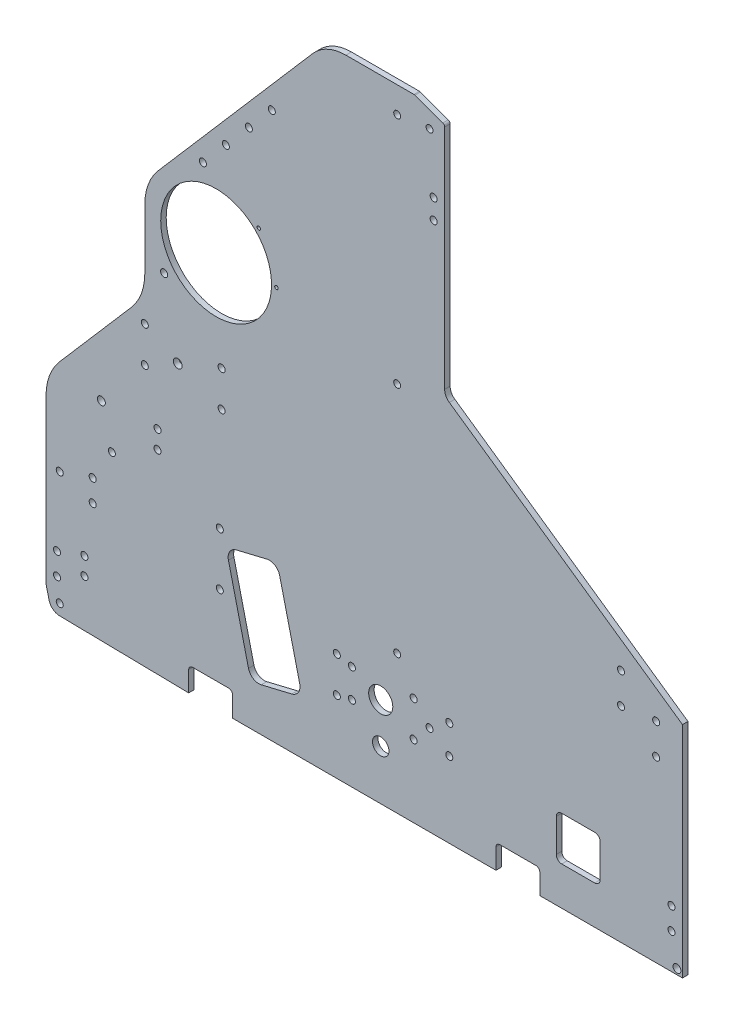
from build123d import *

# Parameters (mm, degrees)
SKETCH1_R           = 2.032
SKETCH1_R_2         = 2.54
SKETCH1_R_3         = 2
BOSS_EXTRUDE1_DEPTH = 3.175
FILLET1_R           = 2.286
FILLET2_R           = 6.35
SKETCH2_R           = 2.032
CUT_EXTRUDE1_DEPTH  = 505.524983177
FILLET3_R           = 1.5875
SKETCH3_R           = 2.032
SKETCH3_R_2         = 2.286
SKETCH3_R_3         = 1.016
CUT_EXTRUDE2_DEPTH  = 505.524983177
SKETCH4_R           = 2.032
SKETCH4_R_2         = 6.985
SKETCH4_R_3         = 4.7625
CUT_EXTRUDE3_DEPTH  = 505.524983177
SKETCH5_R           = 32.0675
SKETCH5_R_2         = 2.286
CUT_EXTRUDE5_DEPTH  = 540.282510524
FILLET4_R           = 31.75
CUT_EXTRUDE6_DEPTH  = 505.524983177
SKETCH7_R           = 2.032
CUT_EXTRUDE7_DEPTH  = 2.54
FILLET5_R           = 25.4


with BuildPart() as part:
    # Sketch1 → Boss-Extrude1 (new body)
    with BuildSketch(Plane.XY):
        with BuildLine():
            Line((7.829508682, -19.049081656), (82.55, -20.32))
            Line((82.55, -20.32), (82.55, -6.35))
            Line((82.55, -6.35), (107.95, -6.35))
            Line((107.95, -6.35), (107.95, -20.32))
            Line((107.95, -20.32), (260.35, -20.32))
            Line((260.35, -20.32), (260.35, -6.35))
            Line((260.35, -6.35), (285.75, -6.35))
            Line((285.75, -6.35), (285.75, -20.32))
            Line((285.75, -20.32), (368.3, -20.32))
            Line((368.3, -20.32), (368.3, 106.68))
            Line((368.3, 106.68), (230.66375, 202.565))
            Line((230.66375, 202.565), (230.66375, 338.455))
            Line((230.66375, 338.455), (213.19998, 344.805))
            Line((213.19998, 344.805), (203.2, 344.805))
            Line((203.2, 344.805), (161.925, 344.805))
            Line((161.925, 344.805), (52.720122664, 218.469945827))
            ThreePointArc((52.720122664, 218.469945827), (52.803835479, 218.142145922), (52.832, 217.805))
            ThreePointArc((52.832, 217.805), (52.095493096, 216.239521914), (50.419872403, 215.808871996))
            Line((50.419872403, 215.808871996), (0, 157.48))
            Line((0, 157.48), (0, 0))
            Line((0, 0), (0, -6.35))
            ThreePointArc((0, -6.35), (0.047577015, -7.125863724), (0.189595124, -7.890101219))
            Line((0.189595124, -7.890101219), (1.777095124, -14.240101219))
            ThreePointArc((1.777095124, -14.240101219), (3.987212552, -17.671692778), (7.829508682, -19.049081656))
        make_face()
        with Locations((7.9375, -12.7)):
            Circle(SKETCH1_R, mode=Mode.SUBTRACT)
        with Locations((6.35, 0)):
            Circle(SKETCH1_R, mode=Mode.SUBTRACT)
        with Locations((6.35, 12.7)):
            Circle(SKETCH1_R, mode=Mode.SUBTRACT)
        with Locations((38.1, 78.105)):
            Circle(SKETCH1_R, mode=Mode.SUBTRACT)
        with Locations((57.15, 131.28625)):
            Circle(SKETCH1_R, mode=Mode.SUBTRACT)
        with Locations((57.15, 151.92375)):
            Circle(SKETCH1_R, mode=Mode.SUBTRACT)
        with Locations((76.2, 141.605)):
            Circle(SKETCH1_R_2, mode=Mode.SUBTRACT)
        with Locations((101.6, 131.28625)):
            Circle(SKETCH1_R, mode=Mode.SUBTRACT)
        with Locations((101.6, 151.92375)):
            Circle(SKETCH1_R, mode=Mode.SUBTRACT)
        with Locations((203.2, 59.805)):
            Circle(SKETCH1_R_3, mode=Mode.SUBTRACT)
        with Locations((361.95, 0)):
            Circle(SKETCH1_R, mode=Mode.SUBTRACT)
        with Locations((361.95, 12.7)):
            Circle(SKETCH1_R, mode=Mode.SUBTRACT)
        with Locations((353.06, 82.955052336)):
            Circle(SKETCH1_R, mode=Mode.SUBTRACT)
        with Locations((332.74, 98.195052336)):
            Circle(SKETCH1_R, mode=Mode.SUBTRACT)
        with Locations((332.74, 115.975052336)):
            Circle(SKETCH1_R, mode=Mode.SUBTRACT)
        with Locations((353.06, 100.735052336)):
            Circle(SKETCH1_R, mode=Mode.SUBTRACT)
        with Locations((68.326, 182.923674932)):
            Circle(SKETCH1_R, mode=Mode.SUBTRACT)
        with Locations((76.2, 217.805)):
            Circle(SKETCH1_R, mode=Mode.SUBTRACT)
        with Locations((90.779500502, 249.682)):
            Circle(SKETCH1_R, mode=Mode.SUBTRACT)
        with Locations((104.067838673, 265.054783374)):
            Circle(SKETCH1_R, mode=Mode.SUBTRACT)
        with Locations((117.356176844, 280.427566748)):
            Circle(SKETCH1_R, mode=Mode.SUBTRACT)
        with Locations((130.644515014, 295.800350122)):
            Circle(SKETCH1_R, mode=Mode.SUBTRACT)
        with Locations((203.2, 194.805)):
            Circle(SKETCH1_R_3, mode=Mode.SUBTRACT)
        with Locations((224.31375, 287.401)):
            Circle(SKETCH1_R, mode=Mode.SUBTRACT)
        with Locations((224.31375, 298.831)):
            Circle(SKETCH1_R, mode=Mode.SUBTRACT)
        with Locations((203.2, 329.805)):
            Circle(SKETCH1_R_3, mode=Mode.SUBTRACT)
        with Locations((221.931865, 332.105)):
            Circle(SKETCH1_R_3, mode=Mode.SUBTRACT)
    extrude(amount=BOSS_EXTRUDE1_DEPTH)

    # Fillet1
    fillet1_edges = [part.edges().sort_by_distance(p)[0] for p in [
        (285.75, -6.35, 1.5875),
        (107.95, -6.35, 1.5875),
        (260.35, -6.35, 1.5875),
        (82.55, -6.35, 1.5875),
    ]]
    fillet(fillet1_edges, radius=FILLET1_R)

    # Fillet2
    fillet2_edges = [part.edges().sort_by_distance(p)[0] for p in [
        (230.66375, 202.565, 1.5875),
    ]]
    fillet(fillet2_edges, radius=FILLET2_R)

    # Sketch2 → Cut-Extrude1 (cut, through all)
    with BuildSketch(Plane(origin=(0, 0, 0), x_dir=(-1, 0, 0), z_dir=(0, 0, -1))):
        with Locations((-100.552770272, 71.086035298)):
            Circle(SKETCH2_R)
        with Locations((-100.552770272, 40.606035298)):
            Circle(SKETCH2_R)
        with Locations((-22.225, 18.202541089)):
            Circle(SKETCH2_R)
        with Locations((-22.225, 8.042541089)):
            Circle(SKETCH2_R)
    extrude(amount=-CUT_EXTRUDE1_DEPTH, mode=Mode.SUBTRACT)

    # Fillet3
    fillet3_edges = [part.edges().sort_by_distance(p)[0] for p in [
        (230.66375, 338.455, 1.5875),
        (213.19998, 344.805, 1.5875),
    ]]
    fillet(fillet3_edges, radius=FILLET3_R)

    # Sketch3 → Cut-Extrude2 (cut, through all)
    with BuildSketch(Plane.XY.offset(3.175)):
        with BuildLine():
            Line((127.789357836, 69.359781229), (110.090757964, 65.117192092))
            ThreePointArc((110.090757964, 65.117192092), (106.28794748, 62.356296076), (105.551202695, 57.715054701))
            Line((105.551202695, 57.715054701), (117.160045499, 9.28701769))
            ThreePointArc((117.160045499, 9.28701769), (119.920941515, 5.484207206), (124.56218289, 4.74746242))
            Line((124.56218289, 4.74746242), (142.260782762, 8.990051558))
            ThreePointArc((142.260782762, 8.990051558), (146.063593246, 11.750947574), (146.800338031, 16.392188949))
            Line((146.800338031, 16.392188949), (135.191495227, 64.82022596))
            ThreePointArc((135.191495227, 64.82022596), (132.430599211, 68.623036444), (127.789357836, 69.359781229))
        make_face()
        with Locations((26.987500002, 46.953113935)):
            Circle(SKETCH3_R)
        with Locations((26.987500002, 59.653113935)):
            Circle(SKETCH3_R)
        with Locations((7.937500002, 53.303113935)):
            Circle(SKETCH3_R)
        with Locations((32.03059934, 100.810872615)):
            Circle(SKETCH3_R_2)
        with Locations((64.525942114, 102.94048958)):
            Circle(SKETCH3_R)
        with Locations((64.525942114, 92.525786339)):
            Circle(SKETCH3_R)
        with Locations((133.35, 208.228121768)):
            Circle(SKETCH3_R_3)
        with Locations((123.120704333, 232.923826101)):
            Circle(SKETCH3_R_3)
    extrude(amount=-CUT_EXTRUDE2_DEPTH, mode=Mode.SUBTRACT)

    # Sketch4 → Cut-Extrude3 (cut, through all)
    with BuildSketch(Plane.XY.offset(3.175)):
        with Locations((168.275, 42.06875)):
            Circle(SKETCH4_R)
        with Locations((212.725, 42.06875)):
            Circle(SKETCH4_R)
        with Locations((212.725, 21.43125)):
            Circle(SKETCH4_R)
        with Locations((168.275, 21.43125)):
            Circle(SKETCH4_R)
        with Locations((193.675, 31.75)):
            Circle(SKETCH4_R_2)
        with Locations((177.00498, 40.0431)):
            Circle(SKETCH4_R)
        with Locations((177.00498, 23.4569)):
            Circle(SKETCH4_R)
        with Locations((193.675, 8.466666658)):
            Circle(SKETCH4_R_3)
        with Locations((221.931865, 31.75)):
            Circle(SKETCH4_R)
        with Locations((233.36123, 23.4569)):
            Circle(SKETCH4_R)
        with Locations((233.36123, 40.0431)):
            Circle(SKETCH4_R)
    extrude(amount=-CUT_EXTRUDE3_DEPTH, mode=Mode.SUBTRACT)

    # Sketch5 → Cut-Extrude5 (cut, through all)
    with BuildSketch(Plane(origin=(0, 0, -187.324995096), x_dir=(-1, 0, 0), z_dir=(0, 0, -1))):
        Polygon((0, 157.48), (-57.15, 223.594705882), (-57.15, 165.333696112), (0, 99.218990229), align=None)
        with Locations((-98.425, 208.228121768)):
            Circle(SKETCH5_R)
        with Locations((-365.124999998, -17.144978643)):
            Circle(SKETCH5_R_2)
    extrude(amount=-CUT_EXTRUDE5_DEPTH, mode=Mode.SUBTRACT)

    # Fillet4
    fillet4_edges = [part.edges().sort_by_distance(p)[0] for p in [
        (0, 99.218990229, 1.5875),
        (57.15, 165.333696112, 1.5875),
        (57.15, 223.594705882, 1.5875),
    ]]
    fillet(fillet4_edges, radius=FILLET4_R)

    # Sketch6 → Cut-Extrude6 (cut, through all)
    with BuildSketch(Plane.XY.offset(3.175)):
        with BuildLine():
            Line((298.45, 27.305), (317.5, 27.305))
            ThreePointArc((317.5, 27.305), (319.74506403, 26.37506403), (320.675, 24.13))
            Line((320.675, 24.13), (320.675, 5.08))
            ThreePointArc((320.675, 5.08), (319.74506403, 2.83493597), (317.5, 1.905))
            Line((317.5, 1.905), (298.45, 1.905))
            ThreePointArc((298.45, 1.905), (296.20493597, 2.83493597), (295.275, 5.08))
            Line((295.275, 5.08), (295.275, 24.13))
            ThreePointArc((295.275, 24.13), (296.20493597, 26.37506403), (298.45, 27.305))
        make_face()
    extrude(amount=-CUT_EXTRUDE6_DEPTH, mode=Mode.SUBTRACT)

    # Sketch7 → Cut-Extrude7 (cut)
    with BuildSketch(Plane(origin=(0, 0, 0), x_dir=(-1, 0, 0), z_dir=(0, 0, -1))):
        with Locations((-215.9, 306.704993868)):
            Circle(SKETCH7_R)
        with Locations((-203.2, 306.704993868)):
            Circle(SKETCH7_R)
        with Locations((-190.5, 306.704993868)):
            Circle(SKETCH7_R)
        with Locations((-177.8, 306.704993868)):
            Circle(SKETCH7_R)
        with Locations((-215.9, 255.904993868)):
            Circle(SKETCH7_R)
        with Locations((-203.2, 255.904993868)):
            Circle(SKETCH7_R)
        with Locations((-190.5, 255.904993868)):
            Circle(SKETCH7_R)
        with Locations((-177.8, 255.904993868)):
            Circle(SKETCH7_R)
    extrude(amount=-CUT_EXTRUDE7_DEPTH, mode=Mode.SUBTRACT)

    # Fillet5
    fillet5_edges = [part.edges().sort_by_distance(p)[0] for p in [
        (161.925, 344.805, 1.5875),
    ]]
    fillet(fillet5_edges, radius=FILLET5_R)


solid = part.part
